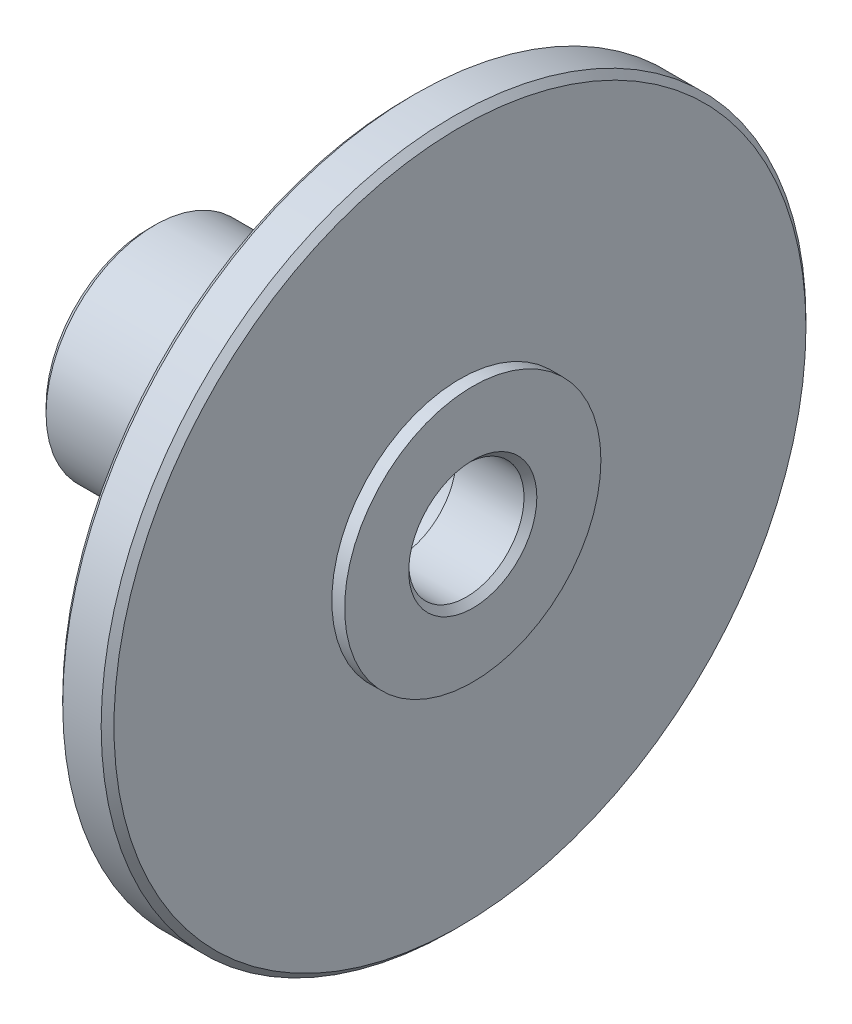
from build123d import *

# Parameters (mm, degrees)
SKETCH1_W           = 4
SKETCH1_H           = 27.5
SKETCH2_R           = 10
BOSS_EXTRUDE1_DEPTH = 1
SKETCH3_R           = 9.5
BOSS_EXTRUDE2_DEPTH = 8.1
SKETCH4_R           = 8.5
BOSS_EXTRUDE3_DEPTH = 12.2
CUT_EXTRUDE1_DEPTH  = 19.5
HOLE1_D             = 5
HOLE1_DEPTH         = 25.3
HOLE1_CBORE_D       = 9
HOLE1_CBORE_DEPTH   = 10
CHAMFER1_SIZE       = 0.5
FILLET1_R           = 1
FILLET2_R           = 4


with BuildPart() as part:
    # Sketch1 → Revolve1 (revolve)
    with BuildSketch(Plane(origin=(0, 0, 216.5), x_dir=(-1, 0, 0), z_dir=(0, 0, -1)), mode=Mode.PRIVATE) as revolve1_sk:
        with Locations((-182.6, -12.75)):
            Rectangle(SKETCH1_W, SKETCH1_H)
    revolve(revolve1_sk.sketch.rotate(Axis((184.6, -26.5, 216.5), (-1, 0, 0)), 270), axis=Axis((184.6, -26.5, 216.5), (-1, 0, 0)))

    # Sketch2 → Boss-Extrude1 (add)
    with BuildSketch(Plane(origin=(184.6, 0, 0), x_dir=(0, 0, -1), z_dir=(1, 0, 0))):
        with Locations((-216.5, -26.5)):
            Circle(SKETCH2_R)
    extrude(amount=BOSS_EXTRUDE1_DEPTH)

    # Sketch3 → Boss-Extrude2 (add)
    with BuildSketch(Plane.ZY.offset(-180.6)):
        with Locations((216.5, -26.5)):
            Circle(SKETCH3_R)
    extrude(amount=BOSS_EXTRUDE2_DEPTH)

    # Sketch4 → Boss-Extrude3 (add)
    with BuildSketch(Plane.ZY.offset(-172.5)):
        with Locations((216.5, -26.5)):
            Circle(SKETCH4_R)
    extrude(amount=BOSS_EXTRUDE3_DEPTH)

    # Sketch5 → Cut-Extrude1 (cut)
    with BuildSketch(Plane.ZY.offset(-160.3)):
        with BuildLine():
            Line((220.906082937, -25.249228687), (217.750771313, -22.093917063))
            ThreePointArc((217.750771313, -22.093917063), (216.434925146, -20.269610576), (214.788393439, -21.802085252))
            ThreePointArc((214.788393439, -21.802085252), (212.964466094, -30.035533906), (221.197914748, -28.211606561))
            ThreePointArc((221.197914748, -28.211606561), (222.730389424, -26.565074854), (220.906082937, -25.249228687))
        make_face()
    extrude(amount=-CUT_EXTRUDE1_DEPTH, mode=Mode.SUBTRACT)

    # Hole1
    with Locations(Plane(origin=(185.6, 0, 0), x_dir=(0, 0, -1), z_dir=(1, 0, 0))):
        with Locations((-216.5, -26.5)):
            CounterBoreHole(HOLE1_D / 2, HOLE1_CBORE_D / 2, HOLE1_CBORE_DEPTH, depth=HOLE1_DEPTH)

    # Chamfer1
    chamfer1_edges = [part.edges().sort_by_distance(p)[0] for p in [
        (160.3, -26.5, 208),
        (180.6, -26.5, 189),
        (185.6, -26.5, 221),
        (184.6, -26.5, 189),
    ]]
    chamfer(chamfer1_edges, length=CHAMFER1_SIZE)

    # Fillet1
    # the kernel refuses this fillet: 1 mm, written as the material it takes off along each edge
    with BuildSketch(Plane(origin=(159.134806492, -25.249228687, 220.906082937), x_dir=(0, 0.7071067811864904, -0.7071067811866047), z_dir=(1, 0, 0))) as fillet1_piece_1:
        with BuildLine():
            CenterArc((0.466077403, 1), FILLET1_R, 226.054480438, 43.945519562)
            ThreePointArc((-0.22789666, 0.28), (-0.105493762, 0.146881314), (0, 0))
            Line((0, 0), (0.466077403, 0))
        make_face()
    extrude(amount=20.665193508, mode=Mode.SUBTRACT)
    with BuildSketch(Plane(origin=(159.134806492, -22.093917063, 217.750771313), x_dir=(0, -0.7071067811865017, 0.7071067811865932), z_dir=(1, 0, 0))) as fillet1_piece_2:
        with BuildLine():
            CenterArc((0.466077403, -1), FILLET1_R, 90, 43.945519562)
            ThreePointArc((-0.22789666, -0.28), (-0.105493762, -0.146881314), (0, 0))
            Line((0, 0), (0.466077403, 0))
        make_face()
    extrude(amount=20.665193508, mode=Mode.SUBTRACT)
    with BuildSketch(Plane(origin=(159.010183368, -28.211606561, 221.197914748), x_dir=(0, -0.9206703550954229, -0.39034100123925997), z_dir=(1, 0, 0))) as fillet1_piece_3:
        with BuildLine():
            CenterArc((0.567519318, -0.998668212), FILLET1_R, 92.957354948, 48.80173568)
            ThreePointArc((-0.217895829, -0.37969887), (-0.095021383, -0.197841382), (0, 0))
            ThreePointArc((0, 0), (0.257963326, -0.006658942), (0.515926653, 0))
        make_face()
    extrude(amount=20.789816632, mode=Mode.SUBTRACT)
    with BuildSketch(Plane(origin=(159.010183368, -21.802085252, 214.788393439), x_dir=(0, -0.3903410012394471, -0.9206703550953437), z_dir=(1, 0, 0))) as fillet1_piece_4:
        with BuildLine():
            CenterArc((0.567519318, 0.998668212), FILLET1_R, 218.240909372, 48.80173568)
            ThreePointArc((-0.217895829, 0.37969887), (-0.095021383, 0.197841382), (0, 0))
            ThreePointArc((0, 0), (0.257963326, 0.006658942), (0.515926653, 0))
        make_face()
    extrude(amount=20.789816632, mode=Mode.SUBTRACT)

    # Fillet2
    fillet2_edges = [part.edges().sort_by_distance(p)[0] for p in [
        (180.6, -26.5, 207),
    ]]
    fillet(fillet2_edges, radius=FILLET2_R)


solid = part.part
